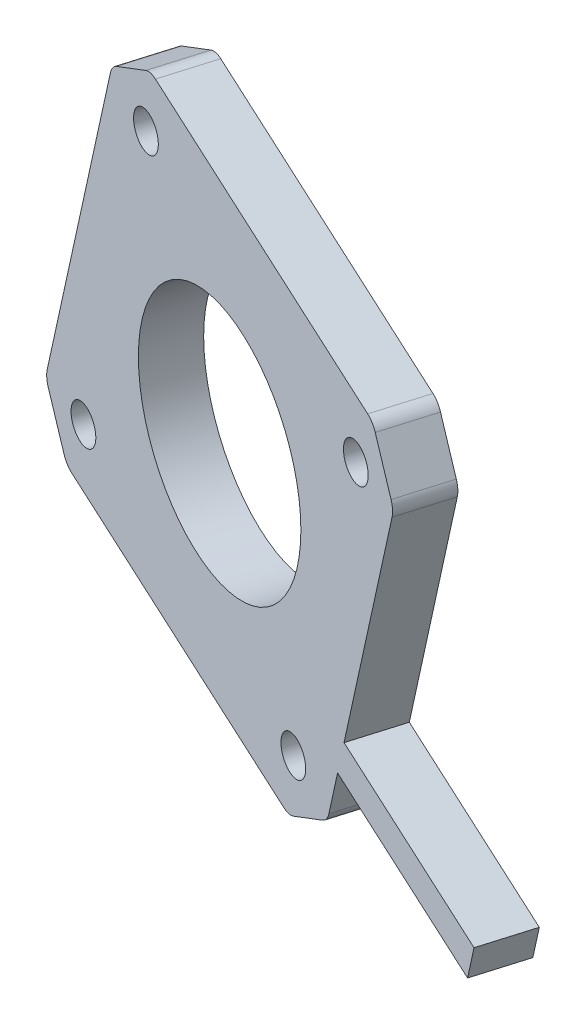
from build123d import *

# Parameters (mm, degrees)
SKETCH1_R           = 11.5
SKETCH1_R_2         = 1.75
BOSS_EXTRUDE1_DEPTH = 5


with BuildPart() as part:
    # Sketch1 → Boss-Extrude1 (new body)
    with BuildSketch(Plane(origin=(11.209104981, 0, -37.651050455), x_dir=(0.9185845521656112, -0.28533392338519575, 0.27347206930199425), z_dir=(0.2853339233851958, 0, -0.9584281674521107))):
        with BuildLine():
            Line((214.043970363, 47.315343119), (233.243970363, 47.315343119))
            Line((233.243970363, 47.315343119), (233.243970363, 50.515343119))
            Line((233.243970363, 50.515343119), (214.043970363, 50.515343119))
            Line((214.043970363, 50.515343119), (214.043970363, 54.836915994))
            ThreePointArc((214.043970363, 54.836915994), (213.906953521, 55.525746173), (213.516762569, 56.1097082))
            Line((213.516762569, 56.1097082), (210.188335444, 59.438135325))
            ThreePointArc((210.188335444, 59.438135325), (209.604373416, 59.828326278), (208.915543238, 59.965343119))
            Line((208.915543238, 59.965343119), (177.572397488, 59.965343119))
            ThreePointArc((177.572397488, 59.965343119), (176.883567309, 59.828326278), (176.299605281, 59.438135325))
            Line((176.299605281, 59.438135325), (172.971178157, 56.1097082))
            ThreePointArc((172.971178157, 56.1097082), (172.580987204, 55.525746173), (172.443970363, 54.836915994))
            Line((172.443970363, 54.836915994), (172.443970363, 23.493770244))
            ThreePointArc((172.443970363, 23.493770244), (172.580987204, 22.804940066), (172.971178157, 22.220978038))
            Line((172.971178157, 22.220978038), (176.299605281, 18.892550913))
            ThreePointArc((176.299605281, 18.892550913), (176.883567309, 18.502359961), (177.572397488, 18.365343119))
            Line((177.572397488, 18.365343119), (208.915543238, 18.365343119))
            ThreePointArc((208.915543238, 18.365343119), (209.604373416, 18.502359961), (210.188335444, 18.892550913))
            Line((210.188335444, 18.892550913), (213.516762569, 22.220978038))
            ThreePointArc((213.516762569, 22.220978038), (213.906953521, 22.804940066), (214.043970363, 23.493770244))
            Line((214.043970363, 23.493770244), (214.043970363, 47.315343119))
        make_face()
        with Locations((193.243970363, 39.165343119)):
            Circle(SKETCH1_R, mode=Mode.SUBTRACT)
        with Locations((208.743970363, 54.665343119)):
            Circle(SKETCH1_R_2, mode=Mode.SUBTRACT)
        with Locations((177.743970363, 23.665343119)):
            Circle(SKETCH1_R_2, mode=Mode.SUBTRACT)
        with Locations((208.743970363, 23.665343119)):
            Circle(SKETCH1_R_2, mode=Mode.SUBTRACT)
        with Locations((177.743970363, 54.665343119)):
            Circle(SKETCH1_R_2, mode=Mode.SUBTRACT)
    extrude(amount=BOSS_EXTRUDE1_DEPTH)


solid = part.part
